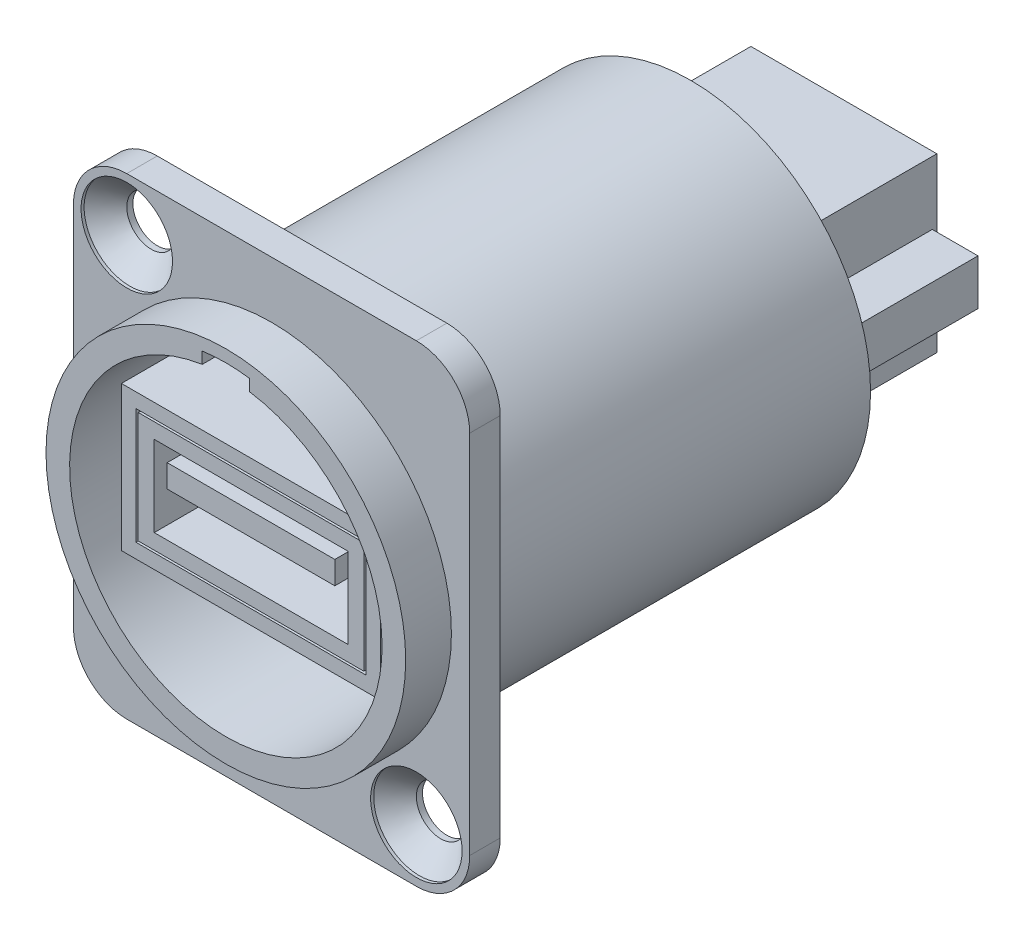
from build123d import *

# Parameters (mm, degrees)
BOSS_EXTRU_1_START                          = -25.5
BOSS_EXTRU_1_OUTLINE_R                      = 11.8
BOSS_EXTRU_1_DEPTH                          = 16.5
BOSS_EXTRU_1_START_2                        = -9
BOSS_EXTRU_1_2_DEPTH                        = 14
BOSS_EXTRU_1_3_DEPTH                        = 2
BOSS_EXTRU_1_4_OUTLINE_W                    = 16
BOSS_EXTRU_1_4_OUTLINE_H                    = 9
BOSS_EXTRU_1_4_DEPTH                        = 1.2
BOSS_EXTRU_1_START_3                        = -7.8
BOSS_EXTRU_1_5_DEPTH                        = 7.8
BOSS_EXTRU_1_START_4                        = 2
BOSS_EXTRU_1_6_DEPTH                        = 3
ESQUISSE2_W                                 = 17
ESQUISSE2_H                                 = 9.5
BOSS_EXTRU_2_DEPTH                          = 11.15
ESQUISSE3_W                                 = 2
ESQUISSE3_H                                 = 27.3
BOSS_EXTRU_3_DEPTH                          = 1.236375462
ESQUISSE4_W                                 = 2
ESQUISSE4_H                                 = 27.3
BOSS_EXTRU_4_DEPTH                          = 1.2
ESQUISSE5_W                                 = 26
ESQUISSE5_H                                 = 2
BOSS_EXTRU_5_DEPTH                          = 3.7
ESQUISSE6_W                                 = 15.1
ESQUISSE6_H                                 = 7.6
ENL_V_MAT_EXTRU_1_DEPTH                     = 11.15
ESQUISSE7_W                                 = 14.8
ESQUISSE7_H                                 = 7.3
BOSS_EXTRU_6_DEPTH                          = 11.15
ESQUISSE8_W                                 = 12.7
ESQUISSE8_H                                 = 5.3
ENL_V_MAT_EXTRU_2_DEPTH                     = 9
ESQUISSE9_W                                 = 11
ESQUISSE9_H                                 = 1.5
BOSS_EXTRU_7_DEPTH                          = 9
ESQUISSE10_W                                = 12.2
ESQUISSE10_H                                = 11.3
BOSS_EXTRU_8_DEPTH                          = 10.05
ESQUISSE11_W                                = 8
ESQUISSE11_H                                = 7.7
ENL_V_MAT_EXTRU_3_DEPTH                     = 9
ESQUISSE12_W                                = 5.5
ESQUISSE12_H                                = 3.1
BOSS_EXTRU_9_DEPTH                          = 9
FRAISAGE_POUR_VIS_T_TE_FRAIS_E_M31_AT_COUNT = 2
FRAISAGE_POUR_VIS_T_TE_FRAIS_E_M31_AT_PITCH = 30.61045573
NERVURE1_START                              = -1.5
NERVURE1_OUTLINE_W                          = 3
NERVURE1_OUTLINE_H                          = 9.75
NERVURE1_DEPTH                              = 3
NERVURE2_START                              = -1.5
NERVURE2_OUTLINE_W                          = 3
NERVURE2_OUTLINE_H                          = 9.75
NERVURE2_DEPTH                              = 3
CHANFREIN1_SIZE                             = 2
CONG_4_R                                    = 3.5


with BuildPart() as part:
    # Boss.-Extru.1: read off the stored shape, not the designer's step
    # Boss.-Extru.1 outline → Boss.-Extru.1 (new body)
    with BuildSketch(Plane.XY.offset(BOSS_EXTRU_1_START)):
        Circle(BOSS_EXTRU_1_OUTLINE_R)
    extrude(amount=BOSS_EXTRU_1_DEPTH)

    # Boss.-Extru.1 2 outline → Boss.-Extru.1 2 (add)
    with BuildSketch(Plane.XY.offset(BOSS_EXTRU_1_START_2)):
        with BuildLine():
            ThreePointArc((11.763624538, 0.92581733), (-11.8, 0), (11.763624538, -0.92581733))
            Line((11.763624538, -0.92581733), (11.763624538, 0.92581733))
        make_face()
        with BuildLine():
            Line((-1.55, 10.132127121), (-1.55, 10.890247931))
            ThreePointArc((-1.55, 10.890247931), (0, 11), (1.55, 10.890247931))
            Line((1.55, 10.890247931), (1.55, 10.132127121))
            ThreePointArc((1.55, 10.132127121), (0, -10.25), (-1.55, 10.132127121))
        make_face(mode=Mode.SUBTRACT)
    extrude(amount=BOSS_EXTRU_1_2_DEPTH)

    # Boss.-Extru.1 3 outline → Boss.-Extru.1 3 (add)
    with BuildSketch(Plane.XY):
        with BuildLine():
            Line((2.9e-08, 11.8), (-11.8, 11.8))
            Line((-11.8, 11.8), (-11.8, 0))
            ThreePointArc((-11.8, 0), (-8.343860008, 8.343860028), (2.9e-08, 11.8))
        make_face()
        with BuildLine():
            ThreePointArc((11.763624538, -0.92581733), (-0.463265826, -11.790902628), (-11.8, 0))
            Line((-11.8, 0), (-11.8, -15.5))
            Line((-11.8, -15.5), (11.763624538, -15.5))
            Line((11.763624538, -15.5), (11.763624538, -0.92581733))
        make_face()
        with BuildLine():
            Line((11.763624538, 11.8), (2.9e-08, 11.8))
            ThreePointArc((2.9e-08, 11.8), (8.009848808, 8.665005602), (11.763624538, 0.92581733))
            Line((11.763624538, 0.92581733), (11.763624538, 11.8))
        make_face()
    extrude(amount=BOSS_EXTRU_1_3_DEPTH)

    # Boss.-Extru.1 4 outline → Boss.-Extru.1 4 (add)
    with BuildSketch(Plane.XY.offset(BOSS_EXTRU_1_START_2)):
        with BuildLine():
            Line((11.763624538, 0.92581733), (11.763624538, -0.92581733))
            ThreePointArc((11.763624538, -0.92581733), (11.8, 0), (11.763624538, 0.92581733))
        make_face()
        Rectangle(BOSS_EXTRU_1_4_OUTLINE_W, BOSS_EXTRU_1_4_OUTLINE_H)
    extrude(amount=BOSS_EXTRU_1_4_DEPTH)

    # Boss.-Extru.1 5 outline → Boss.-Extru.1 5 (add)
    with BuildSketch(Plane.XY.offset(BOSS_EXTRU_1_START_3)):
        with BuildLine():
            Line((11.763624538, 0.92581733), (11.763624538, -0.92581733))
            ThreePointArc((11.763624538, -0.92581733), (11.8, 0), (11.763624538, 0.92581733))
        make_face()
    extrude(amount=BOSS_EXTRU_1_5_DEPTH)

    # Boss.-Extru.1 6 outline → Boss.-Extru.1 6 (add)
    with BuildSketch(Plane.XY.offset(BOSS_EXTRU_1_START_4)):
        with BuildLine():
            Line((11.763624538, 0.92581733), (11.763624538, -0.92581733))
            ThreePointArc((11.763624538, -0.92581733), (11.8, 0), (11.763624538, 0.92581733))
        make_face()
    extrude(amount=BOSS_EXTRU_1_6_DEPTH)

    # Esquisse2 → Boss.-Extru.2 (add)
    with BuildSketch(Plane(origin=(0, 0, -7.8), x_dir=(-1, 0, 0), z_dir=(0, 0, -1))):
        Rectangle(ESQUISSE2_W, ESQUISSE2_H)
    extrude(amount=-BOSS_EXTRU_2_DEPTH)

    # Esquisse3 → Boss.-Extru.3 (add)
    with BuildSketch(Plane(origin=(11.763624538, 0, 0), x_dir=(0, 0, -1), z_dir=(1, 0, 0))):
        with Locations((-1, -1.85)):
            Rectangle(ESQUISSE3_W, ESQUISSE3_H)
    extrude(amount=BOSS_EXTRU_3_DEPTH)

    # Esquisse4 → Boss.-Extru.4 (add)
    with BuildSketch(Plane.ZY.offset(11.8)):
        with Locations((1, -1.85)):
            Rectangle(ESQUISSE4_W, ESQUISSE4_H)
    extrude(amount=BOSS_EXTRU_4_DEPTH)

    # Esquisse5 → Boss.-Extru.5 (add)
    with BuildSketch(Plane(origin=(0, 11.8, 0), x_dir=(-1, 0, 0), z_dir=(0, 1, 0))):
        with Locations((0, 1)):
            Rectangle(ESQUISSE5_W, ESQUISSE5_H)
    extrude(amount=BOSS_EXTRU_5_DEPTH)

    # Esquisse6 → Enlèv. mat.-Extru.1 (cut)
    with BuildSketch(Plane.XY.offset(3.35)):
        Rectangle(ESQUISSE6_W, ESQUISSE6_H)
    extrude(amount=-ENL_V_MAT_EXTRU_1_DEPTH, mode=Mode.SUBTRACT)

    # Esquisse7 → Boss.-Extru.6 (add)
    with BuildSketch(Plane.XY.offset(-7.8)):
        Rectangle(ESQUISSE7_W, ESQUISSE7_H)
    extrude(amount=BOSS_EXTRU_6_DEPTH)

    # Esquisse8 → Enlèv. mat.-Extru.2 (cut)
    with BuildSketch(Plane.XY.offset(3.35)):
        Rectangle(ESQUISSE8_W, ESQUISSE8_H)
    extrude(amount=-ENL_V_MAT_EXTRU_2_DEPTH, mode=Mode.SUBTRACT)

    # Esquisse9 → Boss.-Extru.7 (add)
    with BuildSketch(Plane.XY.offset(-5.65)):
        with Locations((0, 1)):
            Rectangle(ESQUISSE9_W, ESQUISSE9_H)
    extrude(amount=BOSS_EXTRU_7_DEPTH)

    # Esquisse10 → Boss.-Extru.8 (add)
    with BuildSketch(Plane(origin=(0, 0, -25.5), x_dir=(-1, 0, 0), z_dir=(0, 0, -1))):
        Rectangle(ESQUISSE10_W, ESQUISSE10_H)
    extrude(amount=BOSS_EXTRU_8_DEPTH)

    # Esquisse11 → Enlèv. mat.-Extru.3 (cut)
    with BuildSketch(Plane(origin=(0, 0, -35.55), x_dir=(-1, 0, 0), z_dir=(0, 0, -1))):
        with Locations((0, 0.35)):
            Rectangle(ESQUISSE11_W, ESQUISSE11_H)
    extrude(amount=-ENL_V_MAT_EXTRU_3_DEPTH, mode=Mode.SUBTRACT)

    # Esquisse12 → Boss.-Extru.9 (add)
    with BuildSketch(Plane(origin=(0, 0, -26.55), x_dir=(-1, 0, 0), z_dir=(0, 0, -1))):
        with Locations((0, 0.35)):
            Rectangle(ESQUISSE12_W, ESQUISSE12_H)
    extrude(amount=BOSS_EXTRU_9_DEPTH)

    # Esquisse13 → Fraisage pour vis à tête fraisée M31 (revolve, cut)
    with BuildSketch(Plane(origin=(-9.5, 12, 2), x_dir=(0, -1, 0), z_dir=(1, 0, 0))):
        Polygon((0, 0), (0, 37.55), (1.6, 37.55), (1.6, 1.599995685), (3, 0.19999191), (3, 0), align=None)
    fraisage_pour_vis_t_te_frais_e_m31 = revolve(axis=Axis((-9.5, 12, 8.35), (0, 0, -1)), mode=Mode.SUBTRACT)

    # Fraisage pour vis à tête fraisée M31 at: Fraisage pour vis à tête fraisée M31 ×2
    with Locations(*[Vector(0.6207029443655612, -0.7840458244617614, 0) * (i * FRAISAGE_POUR_VIS_T_TE_FRAIS_E_M31_AT_PITCH) for i in range(1, FRAISAGE_POUR_VIS_T_TE_FRAIS_E_M31_AT_COUNT)]):
        add(fraisage_pour_vis_t_te_frais_e_m31, mode=Mode.SUBTRACT)

    # Nervure1: read off the stored shape, not the designer's step
    # Nervure1 outline → Nervure1 (add)
    with BuildSketch(Plane.XZ.offset(NERVURE1_START)):
        with Locations((7.6, -30.375)):
            Rectangle(NERVURE1_OUTLINE_W, NERVURE1_OUTLINE_H)
    extrude(amount=NERVURE1_DEPTH)

    # Nervure2: read off the stored shape, not the designer's step
    # Nervure2 outline → Nervure2 (add)
    with BuildSketch(Plane(origin=(0, 0, 0), x_dir=(1, 0, 0), z_dir=(0, 1, 0)).offset(NERVURE2_START)):
        with Locations((-7.6, 30.375)):
            Rectangle(NERVURE2_OUTLINE_W, NERVURE2_OUTLINE_H)
    extrude(amount=NERVURE2_DEPTH)

    # Chanfrein1
    chanfrein1_edges = [part.edges().sort_by_distance(p)[0] for p in [
        (-4, 4.2, -31.05),
        (4, 4.2, -31.05),
    ]]
    chamfer(chanfrein1_edges, length=CHANFREIN1_SIZE)

    # Congé4
    cong_4_edges = [part.edges().sort_by_distance(p)[0] for p in [
        (13, -15.5, 1),
        (-13, -15.5, 1),
        (13, 15.5, 1),
        (-13, 15.5, 1),
    ]]
    fillet(cong_4_edges, radius=CONG_4_R)


solid = part.part
